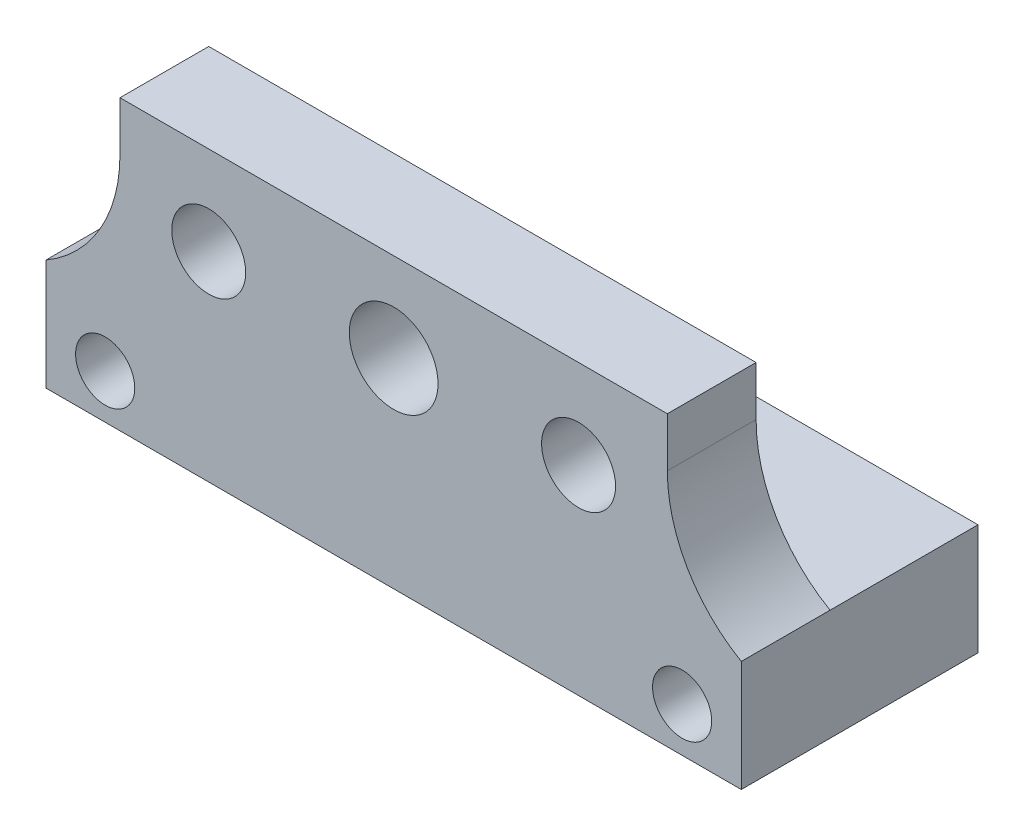
from build123d import *

# Parameters (mm, degrees)
SKETCH1_W                  = 7.4
SKETCH1_H                  = 2.4
BOSS_EXTRUDE1_DEPTH        = 1.2
HOLE1_D                    = 0.6
HOLE1_DEPTH                = 1.2
HOLE1_CBORE_D              = 1
HOLE1_CBORE_DEPTH          = 0.9
HOLE1_TIP                  = 0.180258186
SKETCH11_W                 = 9.4
SKETCH11_H                 = 1.5
BOSS_EXTRUDE5_DEPTH        = 2
FILLET1_R                  = 2
F_0_8_0_8_DIAMETER_HOLE1_D = 0.8
M1_0_CLEARANCE_HOLE1_D     = 1.2


with BuildPart() as part:
    # Sketch1 → Boss-Extrude1 (new body)
    with BuildSketch(Plane.XY.offset(1.2)):
        with Locations((3.7, 1.2)):
            Rectangle(SKETCH1_W, SKETCH1_H)
        Polygon((8.4, 0), (7.4, 0), (0, 0), (-1, 0), (-1, -1.5), (8.4, -1.5), align=None)
    extrude(amount=-BOSS_EXTRUDE1_DEPTH)

    # Hole1
    with Locations(Plane.XY.offset(1.2)):
        with Locations((6.2, 1.2), (1.2, 1.2)):
            CounterBoreHole(HOLE1_D / 2, HOLE1_CBORE_D / 2, HOLE1_CBORE_DEPTH, depth=HOLE1_DEPTH)
            with Locations((0, 0, -(HOLE1_DEPTH + HOLE1_TIP / 2))):  # 118° drill point
                Cone(0, HOLE1_D / 2, HOLE1_TIP, mode=Mode.SUBTRACT)

    # Sketch11 → Boss-Extrude5 (add)
    with BuildSketch(Plane(origin=(0, 0, 0), x_dir=(-1, 0, 0), z_dir=(0, 0, -1))):
        with Locations((-3.7, -0.75)):
            Rectangle(SKETCH11_W, SKETCH11_H)
    extrude(amount=BOSS_EXTRUDE5_DEPTH)

    # Fillet1
    # the kernel refuses this fillet: 2 mm, written as the material it adds along each edge
    with BuildSketch(Plane(origin=(0, 0, 1.2), x_dir=(-1, 0, 0), z_dir=(0, 0, -1))) as fillet1_piece_1:
        with BuildLine():
            CenterArc((2, 1.732050808), FILLET1_R, 180, 60)
            Line((0, 1.732050808), (-0.04, 1.732050808))
            Line((-0.04, 1.732050808), (-0.04, 0))
            Line((-0.04, 0), (0, -0.04))
            ThreePointArc((0, -0.04), (0.5, -0.04), (0.98, -0.034641016))
            Line((0.98, -0.034641016), (1, 0))
        make_face()
    extrude(amount=1.2)
    with BuildSketch(Plane(origin=(7.4, 0, 1.2), x_dir=(1, 0, 0), z_dir=(0, 0, -1))) as fillet1_piece_2:
        with BuildLine():
            CenterArc((2, -1.732050808), FILLET1_R, 120, 60)
            Line((0, -1.732050808), (-0.04, -1.732050808))
            Line((-0.04, -1.732050808), (-0.04, 0))
            Line((-0.04, 0), (0, 0.04))
            ThreePointArc((0, 0.04), (0.5, 0.04), (0.98, 0.034641016))
            Line((0.98, 0.034641016), (1, 0))
        make_face()
    extrude(amount=1.2)

    # Ø0.8 (0.8) Diameter Hole1 (through all)
    with Locations(Plane.XY.offset(1.2)):
        with Locations((-0.2, -0.9), (7.6, -0.9)):
            Hole(F_0_8_0_8_DIAMETER_HOLE1_D / 2)

    # M1.0 Clearance Hole1 (through all)
    with Locations(Plane.XY.offset(1.2)):
        with Locations((3.7, 1.2)):
            Hole(M1_0_CLEARANCE_HOLE1_D / 2)


solid = part.part
